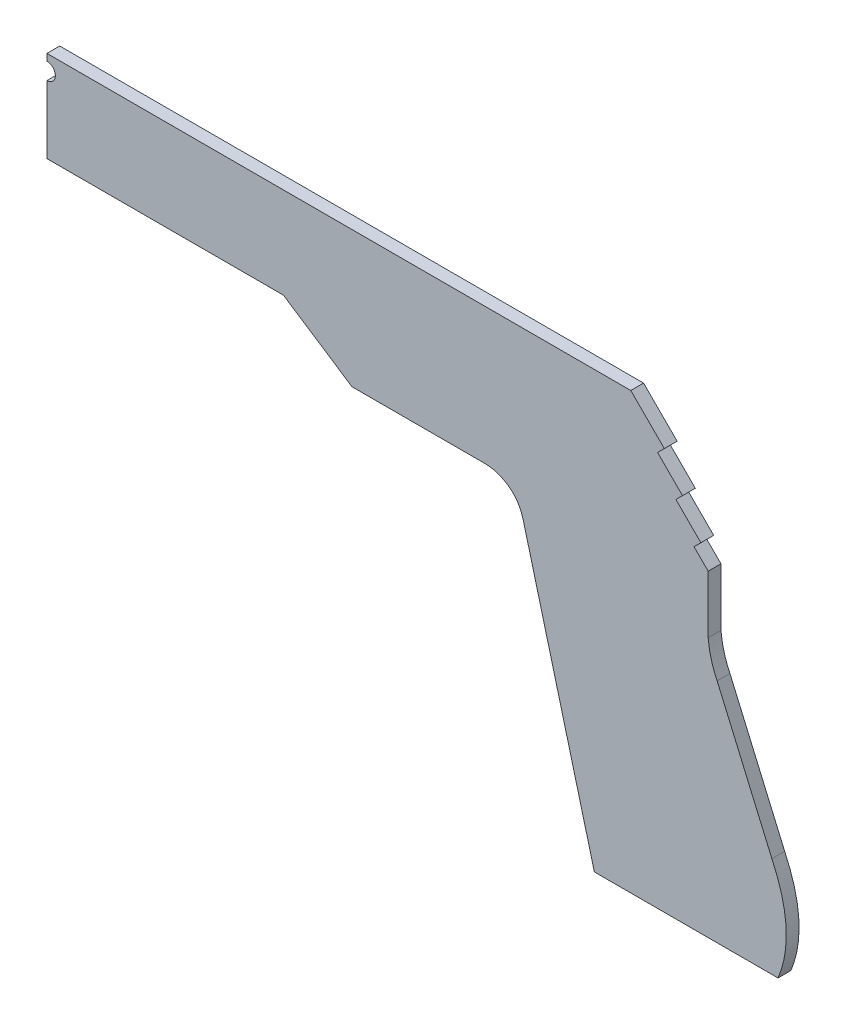
from build123d import *

# Parameters (mm, degrees)
BOSS_EXTRUDE2_DEPTH = 30


with BuildPart() as part:
    # Sketch1 → Boss-Extrude2 (new body)
    with BuildSketch(Plane.XY):
        with BuildLine():
            Line((280.484617565, 1727.504200164), (-1087.734537655, 1727.504200164))
            Line((-1087.734537655, 1727.504200164), (-1087.734537655, 1711.783990023))
            ThreePointArc((-1087.734537655, 1711.783990023), (-1068.036123542, 1692.08557591), (-1087.734537655, 1672.387161797))
            Line((-1087.734537655, 1672.387161797), (-1087.734537655, 1513.926073871))
            Line((-1087.734537655, 1513.926073871), (-533.448080612, 1513.926073871))
            Line((-533.448080612, 1513.926073871), (-372.954156155, 1408.388844287))
            Line((-372.954156155, 1408.388844287), (-57.553549101, 1408.388844287))
            add(Edge.make_bspline(
                [(-9.422960817, 1392.570489498), (-32.218175817, 1407.249741928), (-57.553549101, 1408.388844287)],
                knots=[0, 0, 0, 1, 1, 1], degree=2))
            add(Edge.make_bspline(
                [(28.627041739, 1338.068150913), (19.131793825, 1374.543351751), (-9.422960817, 1392.570489498)],
                knots=[0, 0, 0, 1, 1, 1], degree=2))
            Line((28.627041739, 1338.068150913), (195.148663565, 707.681300778))
            Line((195.148663565, 707.681300778), (625.593239289, 707.681300778))
            add(Edge.make_bspline(
                [(611.121600747, 942.61683209), (670.400494518, 816.596477811), (625.593239289, 707.681300778)],
                knots=[0, 0, 0, 1, 1, 1], degree=2))
            Line((611.121600747, 942.61683209), (482.903846222, 1239.382965103))
            add(Edge.make_bspline(
                [(461.850245167, 1316.418394985), (465.278510736, 1275.186422204), (482.903846222, 1239.382965103)],
                knots=[0, 0, 0, 0.968347313, 0.968347313, 0.968347313], degree=2))
            Line((461.850245167, 1316.418394985), (461.850245167, 1451.421260794))
            Line((461.850245167, 1451.421260794), (428.728717264, 1484.542788696))
            Line((428.728717264, 1484.542788696), (444.817596978, 1500.63166841))
            Line((444.817596978, 1500.63166841), (386.248159303, 1559.201106085))
            Line((386.248159303, 1559.201106085), (401.716938518, 1574.6698853))
            Line((401.716938518, 1574.6698853), (343.288531484, 1633.098292334))
            Line((343.288531484, 1633.098292334), (359.08952844, 1648.899289289))
            Line((359.08952844, 1648.899289289), (280.484617565, 1727.504200164))
        make_face()
    extrude(amount=BOSS_EXTRUDE2_DEPTH)


solid = part.part
